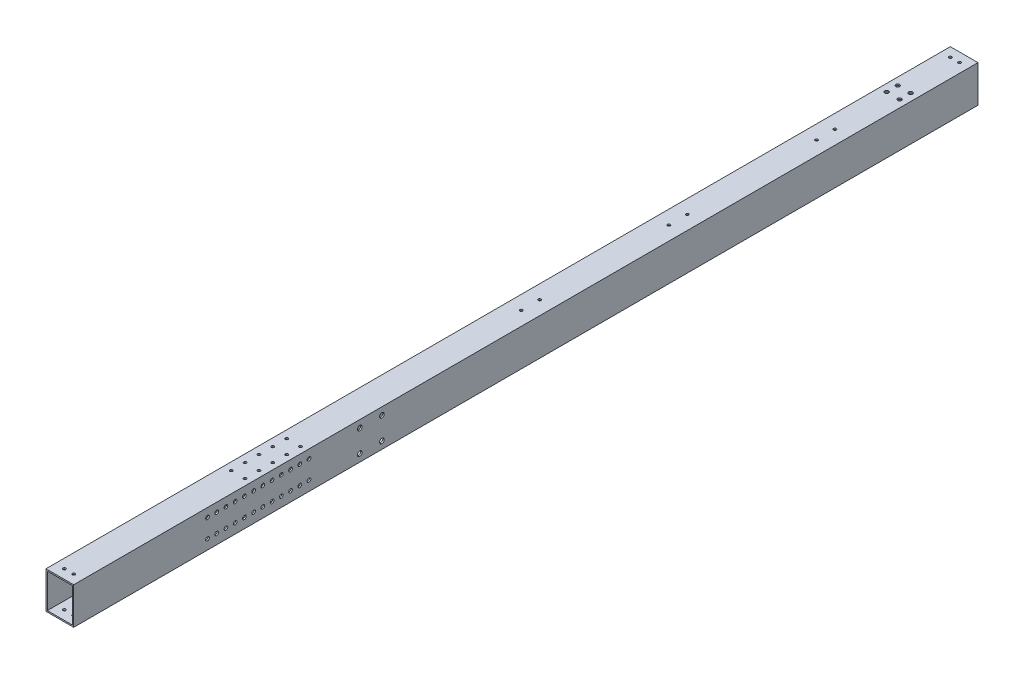
from build123d import *

# Parameters (mm, degrees)
SKETCH_1_W             = 30
SKETCH_1_H             = 40
SKETCH_1_W_2           = 27
SKETCH_1_H_2           = 37
EXTRUDE_1_DEPTH        = 980
SKETCH_3_R             = 1.5
CUT_EXTRUDE_2_DEPTH    = 981.930680527
SKETCH_4_R             = 1.5
CUT_EXTRUDE_3_DEPTH    = 981.930680527
SKETCH_5_R             = 1.5
CUT_EXTRUDE_4_DEPTH    = 981.930680527
CUT_EXTRUDE_6_DEPTH    = 10
SKETCH_9_R             = 3.25
CUT_EXTRUDE_7_DEPTH    = 10
PATTERN_LINEAR_1_COUNT = 4
PATTERN_LINEAR_1_PITCH = 15
SKETCH_10_R            = 2.55
CUT_EXTRUDE_8_DEPTH    = 51
SKETCH_11_R            = 2
CUT_EXTRUDE_9_DEPTH    = 51
SKETCH_12_R            = 2.1
CUT_EXTRUDE_10_DEPTH   = 10
CUT_EXTRUDE_11_DEPTH   = 10


with BuildPart() as part:
    # 草图1 → 凸台-拉伸1 (new body)
    with BuildSketch(Plane.XY):
        Rectangle(SKETCH_1_W, SKETCH_1_H)
        Rectangle(SKETCH_1_W_2, SKETCH_1_H_2, mode=Mode.SUBTRACT)
    extrude(amount=EXTRUDE_1_DEPTH)

    # 草图3 → 切除-拉伸2 (cut, through all)
    with BuildSketch(Plane(origin=(0, 20, 0), x_dir=(-1, 0, 0), z_dir=(0, -1, 0))):
        with Locations((5, -10)):
            Circle(SKETCH_3_R)
        with Locations((-5, -10)):
            Circle(SKETCH_3_R)
        with Locations((-5, -970)):
            Circle(SKETCH_3_R)
        with Locations((5, -970)):
            Circle(SKETCH_3_R)
    extrude(amount=CUT_EXTRUDE_2_DEPTH, mode=Mode.SUBTRACT)

    # 草图4 → 切除-拉伸3 (cut, through all)
    with BuildSketch(Plane(origin=(0, 20, 0), x_dir=(-1, 0, 0), z_dir=(0, -1, 0))):
        with Locations((-8.27006126, -772.5)):
            Circle(SKETCH_4_R)
        with Locations((6.72993874, -772.5)):
            Circle(SKETCH_4_R)
        with Locations((6.72993874, -787.5)):
            Circle(SKETCH_4_R)
        with Locations((-8.27006126, -787.5)):
            Circle(SKETCH_4_R)
    cut_extrude_3 = extrude(amount=CUT_EXTRUDE_3_DEPTH, mode=Mode.SUBTRACT)

    # 草图5 → 切除-拉伸4 (cut, through all)
    with BuildSketch(Plane(origin=(0, 20, 0), x_dir=(-1, 0, 0), z_dir=(0, -1, 0))):
        with Locations((0, -140)):
            Circle(SKETCH_5_R)
        with Locations((0, -160)):
            Circle(SKETCH_5_R)
        with Locations((0, -300)):
            Circle(SKETCH_5_R)
        with Locations((0, -320)):
            Circle(SKETCH_5_R)
        with Locations((0, -480)):
            Circle(SKETCH_5_R)
        with Locations((0, -460)):
            Circle(SKETCH_5_R)
    extrude(amount=CUT_EXTRUDE_4_DEPTH, mode=Mode.SUBTRACT)

    # 草图8 → 切除-拉伸6 (cut)
    with BuildSketch(Plane.XZ.offset(20)):
        with BuildLine():
            Line((7.5, 160), (7.5, 140))
            ThreePointArc((7.5, 140), (0, 132.5), (-7.5, 140))
            Line((-7.5, 140), (-7.5, 160))
            ThreePointArc((-7.5, 160), (0, 167.5), (7.5, 160))
        make_face()
        with BuildLine():
            Line((7.5, 480), (7.5, 460))
            ThreePointArc((7.5, 460), (0, 452.5), (-7.5, 460))
            Line((-7.5, 460), (-7.5, 480))
            ThreePointArc((-7.5, 480), (0, 487.5), (7.5, 480))
        make_face()
        with BuildLine():
            Line((7.5, 320), (7.5, 300))
            ThreePointArc((7.5, 300), (0, 292.5), (-7.5, 300))
            Line((-7.5, 300), (-7.5, 320))
            ThreePointArc((-7.5, 320), (0, 327.5), (7.5, 320))
        make_face()
    extrude(amount=-CUT_EXTRUDE_6_DEPTH, mode=Mode.SUBTRACT)

    # 草图9 → 切除-拉伸7 (cut)
    with BuildSketch(Plane.XZ.offset(20)):
        with Locations((-6.72993874, 787.5)):
            Circle(SKETCH_9_R)
        with Locations((-6.72993874, 772.5)):
            Circle(SKETCH_9_R)
        with Locations((8.27006126, 772.5)):
            Circle(SKETCH_9_R)
        with Locations((8.27006126, 787.5)):
            Circle(SKETCH_9_R)
    cut_extrude_7 = extrude(amount=-CUT_EXTRUDE_7_DEPTH, mode=Mode.SUBTRACT)

    # 阵列(线性)1: 切除-拉伸3, 切除-拉伸7 ×4
    with Locations(*[(0, 0, -i * PATTERN_LINEAR_1_PITCH) for i in range(1, PATTERN_LINEAR_1_COUNT)]):
        add(cut_extrude_3, mode=Mode.SUBTRACT)
        add(cut_extrude_7, mode=Mode.SUBTRACT)

    # 草图10 → 切除-拉伸8 (cut)
    with BuildSketch(Plane.ZY.offset(15)):
        with Locations((646, 12)):
            Circle(SKETCH_10_R)
        with Locations((670, 12)):
            Circle(SKETCH_10_R)
        with Locations((646, -12)):
            Circle(SKETCH_10_R)
        with Locations((670, -12)):
            Circle(SKETCH_10_R)
    extrude(amount=-CUT_EXTRUDE_8_DEPTH, mode=Mode.SUBTRACT)

    # 草图11 → 切除-拉伸9 (cut)
    with BuildSketch(Plane.ZY.offset(15)):
        with Locations((725, 10.625214933)):
            Circle(SKETCH_11_R)
        with Locations((725, -9.374785067)):
            Circle(SKETCH_11_R)
        with Locations((735, 10.625214933)):
            Circle(SKETCH_11_R)
        with Locations((735, -9.374785067)):
            Circle(SKETCH_11_R)
        with Locations((745, 10.625214933)):
            Circle(SKETCH_11_R)
        with Locations((745, -9.374785067)):
            Circle(SKETCH_11_R)
        with Locations((755, 10.625214933)):
            Circle(SKETCH_11_R)
        with Locations((755, -9.374785067)):
            Circle(SKETCH_11_R)
        with Locations((765, 10.625214933)):
            Circle(SKETCH_11_R)
        with Locations((765, -9.374785067)):
            Circle(SKETCH_11_R)
        with Locations((775, 10.625214933)):
            Circle(SKETCH_11_R)
        with Locations((775, -9.374785067)):
            Circle(SKETCH_11_R)
        with Locations((785, 10.625214933)):
            Circle(SKETCH_11_R)
        with Locations((785, -9.374785067)):
            Circle(SKETCH_11_R)
        with Locations((795, 10.625214933)):
            Circle(SKETCH_11_R)
        with Locations((795, -9.374785067)):
            Circle(SKETCH_11_R)
        with Locations((805, 10.625214933)):
            Circle(SKETCH_11_R)
        with Locations((805, -9.374785067)):
            Circle(SKETCH_11_R)
        with Locations((815, 10.625214933)):
            Circle(SKETCH_11_R)
        with Locations((815, -9.374785067)):
            Circle(SKETCH_11_R)
        with Locations((825, 10.625214933)):
            Circle(SKETCH_11_R)
        with Locations((825, -9.374785067)):
            Circle(SKETCH_11_R)
        with Locations((835, 10.625214933)):
            Circle(SKETCH_11_R)
        with Locations((835, -9.374785067)):
            Circle(SKETCH_11_R)
    extrude(amount=-CUT_EXTRUDE_9_DEPTH, mode=Mode.SUBTRACT)

    # 草图12 → 切除-拉伸10 (cut)
    with BuildSketch(Plane(origin=(0, 20, 0), x_dir=(1, 0, 0), z_dir=(0, 1, 0))):
        with Locations((-7, -65)):
            Circle(SKETCH_12_R)
        with Locations((-7, -77)):
            Circle(SKETCH_12_R)
        with Locations((7, -77)):
            Circle(SKETCH_12_R)
        with Locations((7, -65)):
            Circle(SKETCH_12_R)
    extrude(amount=-CUT_EXTRUDE_10_DEPTH, mode=Mode.SUBTRACT)

    # 草图13 → 切除-拉伸11 (cut)
    with BuildSketch(Plane.XZ.offset(20)):
        with BuildLine():
            Line((-8.20885401, 70.140843723), (-8.20885401, 99.712723414))
            ThreePointArc((-8.20885401, 99.712723414), (0, 107.921577424), (8.20885401, 99.712723414))
            Line((8.20885401, 99.712723414), (8.20885401, 70.140843723))
            ThreePointArc((8.20885401, 70.140843723), (0, 61.931989713), (-8.20885401, 70.140843723))
        make_face()
    extrude(amount=-CUT_EXTRUDE_11_DEPTH, mode=Mode.SUBTRACT)


solid = part.part
